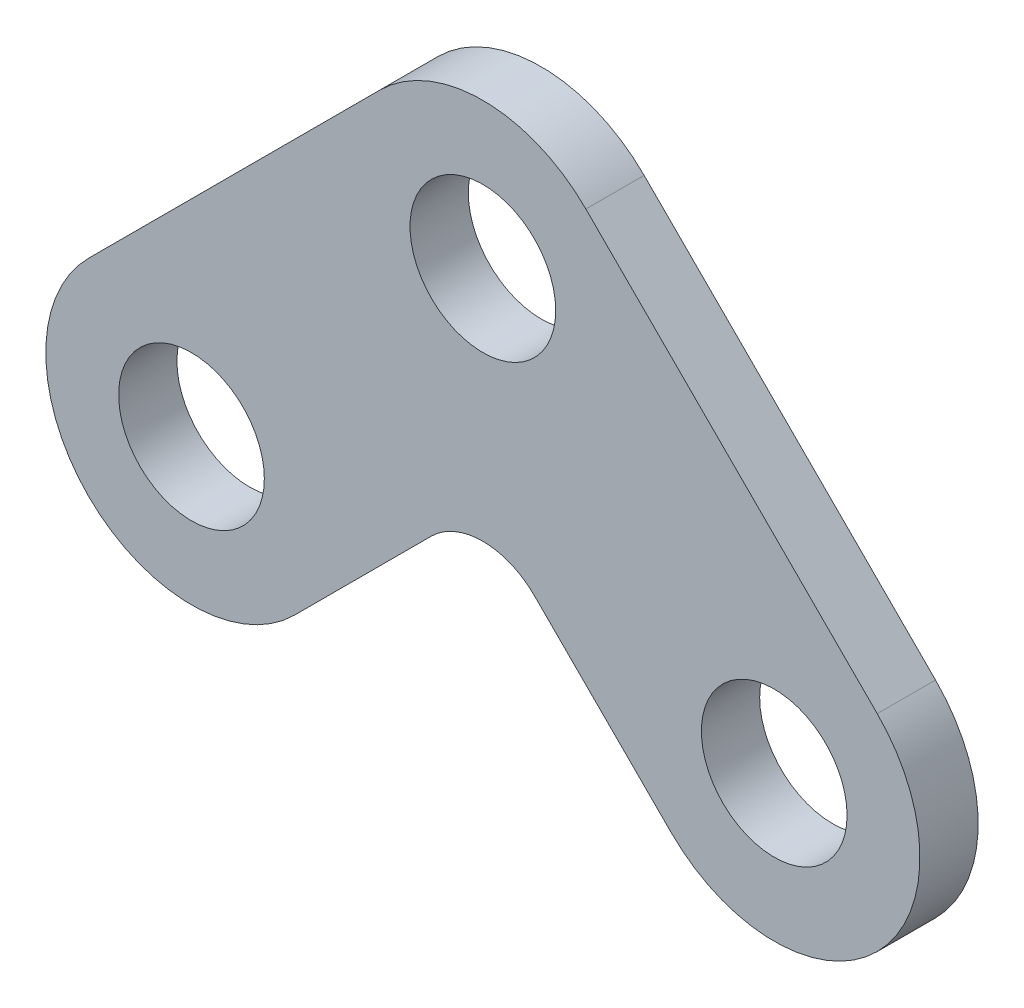
from build123d import *

# Parameters (mm, degrees)
SM_BASE_FLANGE_1_DEPTH = 4
SKETCH_6_R             = 5
CUT_EXTRUDE_1_DEPTH    = 10
FILLET_1_R             = 5


# Sheet-metal steps are written as plain solids
with BuildPart() as part:
    # Sketch 1 → 基体-法兰1 (new body)
    with BuildSketch(Plane.XY):
        with BuildLine():
            Line((-7.071067812, 7.071067812), (-27.071067812, -12.928932188))
            ThreePointArc((-27.071067812, -12.928932188), (-27.071067812, -27.071067812), (-12.928932188, -27.071067812))
            Line((-12.928932188, -27.071067812), (0, -14.142135624))
            Line((0, -14.142135624), (12.928932188, -27.071067812))
            ThreePointArc((12.928932188, -27.071067812), (27.071067812, -27.071067812), (27.071067812, -12.928932188))
            Line((27.071067812, -12.928932188), (7.071067812, 7.071067812))
            ThreePointArc((7.071067812, 7.071067812), (0, 10), (-7.071067812, 7.071067812))
        make_face()
    extrude(amount=-SM_BASE_FLANGE_1_DEPTH)

    # 草图6 → 切除-拉伸1 (cut)
    with BuildSketch(Plane.XY):
        Circle(SKETCH_6_R)
        with Locations((-20, -20)):
            Circle(SKETCH_6_R)
        with Locations((20, -20)):
            Circle(SKETCH_6_R)
    extrude(amount=-CUT_EXTRUDE_1_DEPTH, mode=Mode.SUBTRACT)

    # 圆角1
    fillet_1_edges = [part.edges().sort_by_distance(p)[0] for p in [
        (0, -14.142135624, -2),
    ]]
    fillet(fillet_1_edges, radius=FILLET_1_R)


solid = part.part
